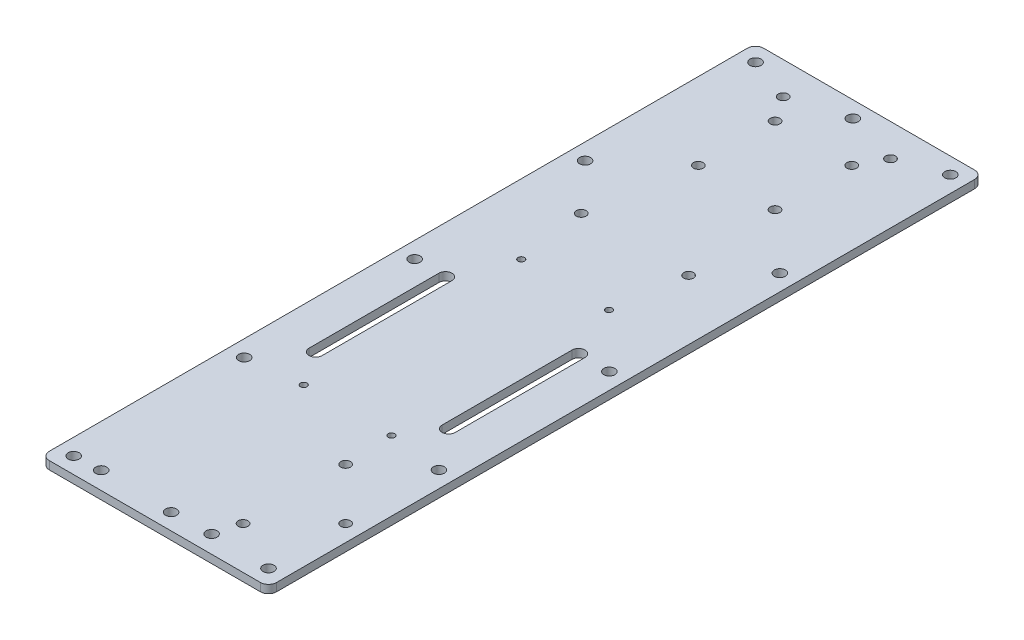
from build123d import *

# Parameters (mm, degrees)
PLATE_THICKNESS_DEPTH      = 3.175
SKETCH3_R                  = 2.159
MOUNTING_HOLES_DEPTH       = 147.635511132
SKETCH4_R                  = 1.905
JETSON_HOLES_W_MOUNT_DEPTH = 147.635511132
SKETCH5_R                  = 1.905
PDB_HOLES_DEPTH            = 147.635511132
SKETCH6_R                  = 1.905
LIDAR_HOLES_DEPTH          = 147.635511132
SKETCH7_R                  = 1.27
PIXHAWK_HOLES_DEPTH        = 147.635511132
BATTERY_HOLES_DEPTH        = 147.635511132
SKETCH9_R                  = 2.159
CUT_EXTRUDE1_DEPTH         = 147.635511132


with BuildPart() as part:
    # Sketch2 → Plate Thickness (new body)
    with BuildSketch(Plane(origin=(0, 0, 0), x_dir=(1, 0, 0), z_dir=(0, 1, 0))):
        with BuildLine():
            Line((-41.275, 139.7), (41.275, 139.7))
            ThreePointArc((41.275, 139.7), (43.52006403, 138.77006403), (44.45, 136.525))
            Line((44.45, 136.525), (44.45, -136.525))
            ThreePointArc((44.45, -136.525), (43.52006403, -138.77006403), (41.275, -139.7))
            Line((41.275, -139.7), (-41.275, -139.7))
            ThreePointArc((-41.275, -139.7), (-43.52006403, -138.77006403), (-44.45, -136.525))
            Line((-44.45, -136.525), (-44.45, 136.525))
            ThreePointArc((-44.45, 136.525), (-43.52006403, 138.77006403), (-41.275, 139.7))
        make_face()
    extrude(amount=PLATE_THICKNESS_DEPTH)

    # Sketch3 → Mounting holes (cut, through all)
    with BuildSketch(Plane(origin=(0, 3.175, 0), x_dir=(1, 0, 0), z_dir=(0, 1, 0))):
        with Locations((-38.1, 133.35)):
            Circle(SKETCH3_R)
        with Locations((-38.1, 66.675)):
            Circle(SKETCH3_R)
        with Locations((-38.1, -66.675)):
            Circle(SKETCH3_R)
        with Locations((-38.1, -133.35)):
            Circle(SKETCH3_R)
        with Locations((38.1, -133.35)):
            Circle(SKETCH3_R)
        with Locations((38.1, -66.675)):
            Circle(SKETCH3_R)
        with Locations((38.1, 66.675)):
            Circle(SKETCH3_R)
        with Locations((38.1, 133.35)):
            Circle(SKETCH3_R)
        with Locations((0, 133.35)):
            Circle(SKETCH3_R)
        with Locations((0, -133.35)):
            Circle(SKETCH3_R)
        with Locations((-38.1, 0)):
            Circle(SKETCH3_R)
        with Locations((38.1, 0)):
            Circle(SKETCH3_R)
    extrude(amount=-MOUNTING_HOLES_DEPTH, mode=Mode.SUBTRACT)

    # Sketch4 → Jetson Holes (w/ mount) (cut, through all)
    with BuildSketch(Plane(origin=(0, 3.175, 0), x_dir=(1, 0, 0), z_dir=(0, 1, 0))):
        with Locations((-21.0058, 127.075242309)):
            Circle(SKETCH4_R)
        with Locations((-21.0058, 48.081242309)):
            Circle(SKETCH4_R)
        with Locations((21.0058, 48.081242309)):
            Circle(SKETCH4_R)
        with Locations((21.0058, 127.075242309)):
            Circle(SKETCH4_R)
    extrude(amount=-JETSON_HOLES_W_MOUNT_DEPTH, mode=Mode.SUBTRACT)

    # Sketch5 → PDB holes (cut, through all)
    with BuildSketch(Plane(origin=(0, 3.175, 0), x_dir=(1, 0, 0), z_dir=(0, 1, 0))):
        with Locations((-14.341868752, 117.235149692)):
            Circle(SKETCH5_R)
        with Locations((15.655531248, 117.235149692)):
            Circle(SKETCH5_R)
        with Locations((15.655531248, 87.237749692)):
            Circle(SKETCH5_R)
        with Locations((-14.341868752, 87.237749692)):
            Circle(SKETCH5_R)
    extrude(amount=-PDB_HOLES_DEPTH, mode=Mode.SUBTRACT)

    # Sketch6 → Lidar Holes (cut, through all)
    with BuildSketch(Plane(origin=(0, 3.175, 0), x_dir=(1, 0, 0), z_dir=(0, 1, 0))):
        with Locations((38.003189405, -103.082806339)):
            Circle(SKETCH6_R)
        with Locations((17.937189405, -83.016806339)):
            Circle(SKETCH6_R)
        with Locations((17.937189405, -123.148806339)):
            Circle(SKETCH6_R)
    extrude(amount=-LIDAR_HOLES_DEPTH, mode=Mode.SUBTRACT)

    # Sketch7 → PixHawk Holes (cut, through all)
    with BuildSketch(Plane(origin=(0, 3.175, 0), x_dir=(1, 0, 0), z_dir=(0, 1, 0))):
        with Locations((-17.145, 20.769931445)):
            Circle(SKETCH7_R)
        with Locations((-17.145, -64.320068555)):
            Circle(SKETCH7_R)
        with Locations((17.145, -64.320068555)):
            Circle(SKETCH7_R)
        with Locations((17.145, 20.769931445)):
            Circle(SKETCH7_R)
    extrude(amount=-PIXHAWK_HOLES_DEPTH, mode=Mode.SUBTRACT)

    # Sketch8 → Battery Holes (cut, through all)
    with BuildSketch(Plane(origin=(0, 3.175, 0), x_dir=(1, 0, 0), z_dir=(0, 1, 0))):
        with BuildLine():
            Line((-23.495, -0.005964701), (-23.495, -50.805964701))
            ThreePointArc((-23.495, -50.805964701), (-26.035, -53.345964701), (-28.575, -50.805964701))
            Line((-28.575, -50.805964701), (-28.575, -0.005964701))
            ThreePointArc((-28.575, -0.005964701), (-26.035, 2.534035299), (-23.495, -0.005964701))
        make_face()
        with BuildLine():
            Line((23.495, -0.005964701), (23.495, -50.805964701))
            ThreePointArc((23.495, -50.805964701), (26.035, -53.345964701), (28.575, -50.805964701))
            Line((28.575, -50.805964701), (28.575, -0.005964701))
            ThreePointArc((28.575, -0.005964701), (26.035, 2.534035299), (23.495, -0.005964701))
        make_face()
    extrude(amount=-BATTERY_HOLES_DEPTH, mode=Mode.SUBTRACT)

    # Sketch9 → Cut-Extrude1 (cut, through all)
    with BuildSketch(Plane(origin=(0, 3.175, 0), x_dir=(1, 0, 0), z_dir=(0, 1, 0))):
        with Locations((-27.868680575, -132.830834732)):
            Circle(SKETCH9_R)
        with Locations((15.311319425, -132.830834732)):
            Circle(SKETCH9_R)
    extrude(amount=-CUT_EXTRUDE1_DEPTH, mode=Mode.SUBTRACT)


solid = part.part
